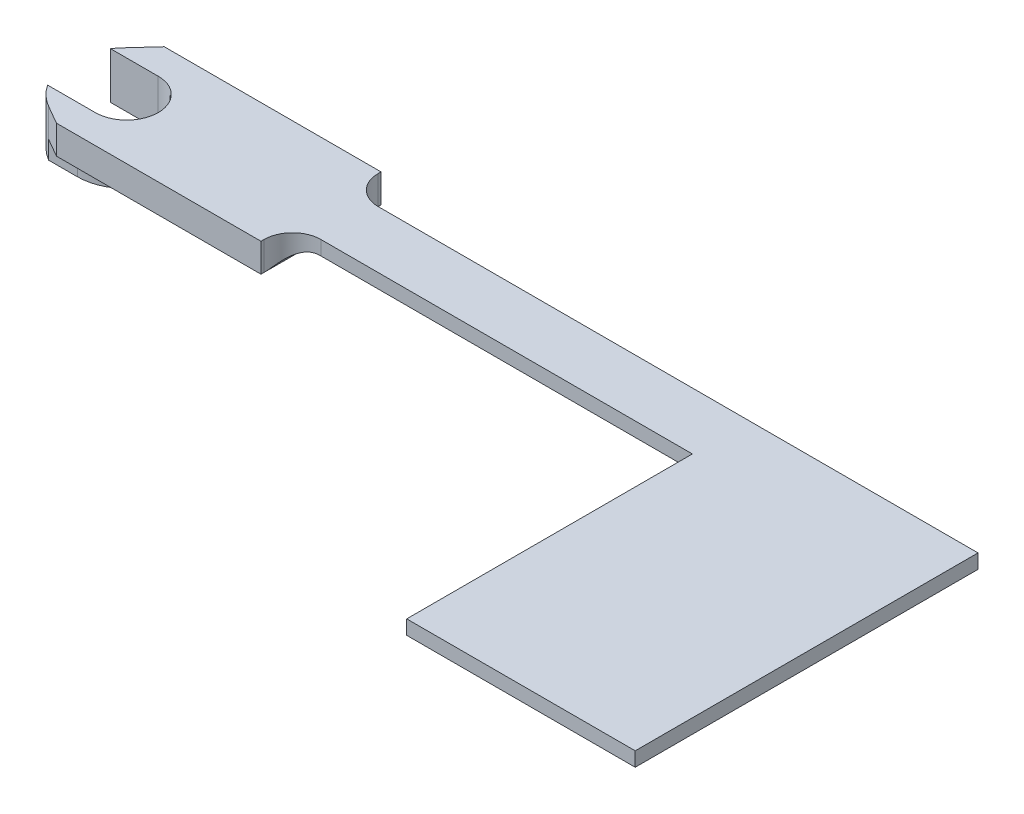
from build123d import *

# Parameters (mm, degrees)
BOSS_EXTRUDE1_DEPTH = 4.7625
SKETCH5_R           = 3.5000057
CUT_EXTRUDE2_DEPTH  = 3.37125
CUT_EXTRUDE3_START  = 1.98
CUT_EXTRUDE3_DEPTH  = 1.98
SKETCH10_W          = 6.35
SKETCH10_H          = 0.79375
SKETCH10_W_2        = 35.745198541
SKETCH10_W_3        = 19.548012242
CUT_EXTRUDE4_DEPTH  = 68.70484365
CUT_EXTRUDE5_DEPTH  = 2.54
BOSS_EXTRUDE2_START = 2
BOSS_EXTRUDE2_DEPTH = 2
CUT_EXTRUDE6_DEPTH  = 62.875089873
BOSS_EXTRUDE4_REACH = 26.955
SKETCH15_W          = 13.3500114
SKETCH15_H          = 3.175
SKETCH15_W_2        = 4.031850112
SKETCH15_H_2        = 1.98
SKETCH20_W          = 13.3500114
SKETCH20_H          = 3.175
BOSS_EXTRUDE7_DEPTH = 3.175
SKETCH21_W          = 25.4
SKETCH21_H          = 31.75
BOSS_EXTRUDE8_DEPTH = 1.5875
FILLET1_R           = 3.175


with BuildPart() as part:
    # Sketch1 → Boss-Extrude1 (new body)
    with BuildSketch(Plane(origin=(0, 0, 0), x_dir=(1, 0, 0), z_dir=(0, 1, 0))):
        with BuildLine():
            Line((23.295952901, 15.613744639), (32.606191406, 26.334377035))
            ThreePointArc((32.606191406, 26.334377035), (32.033289602, 35.241600739), (23.119772343, 34.776777479))
            Line((23.119772343, 34.776777479), (-4.692006503, 4.278735207))
            ThreePointArc((-4.692006503, 4.278735207), (-6.274930424, -0.973523588), (-3.175, -5.499261314))
            Line((-3.175, -5.499261314), (27.78125, -23.371860585))
            ThreePointArc((27.78125, -23.371860585), (37.752424387, -26.756618196), (48.25987898, -26.067923237))
            ThreePointArc((48.25987898, -26.067923237), (49.382410995, -24.123640754), (47.438128512, -23.001108739))
            ThreePointArc((47.438128512, -23.001108739), (21.083895316, -12.623567162), (23.295952901, 15.613744639))
        make_face()
    extrude(amount=BOSS_EXTRUDE1_DEPTH)

    # Sketch5 → Cut-Extrude2 (cut)
    with BuildSketch(Plane.XZ):
        Circle(SKETCH5_R)
        with BuildLine():
            ThreePointArc((0, -3.5000057), (-3.5000057, 0), (0, 3.5000057))
            Line((0, 3.5000057), (-5.298345034, 3.5000057))
            ThreePointArc((-5.298345034, 3.5000057), (-6.35, 0), (-5.298345034, -3.5000057))
            Line((-5.298345034, -3.5000057), (0, -3.5000057))
        make_face()
    extrude(amount=-CUT_EXTRUDE2_DEPTH, mode=Mode.SUBTRACT)

    # Sketch6 → Cut-Extrude3 (cut)
    with BuildSketch(Plane.XZ.offset(-3.37125).offset(CUT_EXTRUDE3_START)):
        with BuildLine():
            Line((17.802786704, -2), (17.802786704, 2))
            Line((17.802786704, 2), (1.802786704, 3))
            ThreePointArc((1.802786704, 3), (3.5000057, 0), (1.802786704, -3))
            Line((1.802786704, -3), (17.802786704, -2))
        make_face()
    extrude(amount=-CUT_EXTRUDE3_DEPTH, mode=Mode.SUBTRACT)

    # Sketch10 → Cut-Extrude4 (cut, through all)
    with BuildSketch(Plane(origin=(-3.175, 0, 5.499261314), x_dir=(0.8660254037844385, 0, 0.5000000000000003), z_dir=(-0.5000000000000003, 0, 0.8660254037844385))):
        with Locations((-3.175, 4.365625)):
            Rectangle(SKETCH10_W, SKETCH10_H)
        with Locations((17.872599271, 4.365625)):
            Rectangle(SKETCH10_W_2, SKETCH10_H)
        with Locations((45.519204662, 4.365625)):
            Rectangle(SKETCH10_W_3, SKETCH10_H)
        with Locations((45.519204662, 0.396875)):
            Rectangle(SKETCH10_W_3, SKETCH10_H)
        with Locations((17.872599271, 0.396875)):
            Rectangle(SKETCH10_W_2, SKETCH10_H)
        with Locations((-3.175, 0.396875)):
            Rectangle(SKETCH10_W, SKETCH10_H)
    extrude(amount=-CUT_EXTRUDE4_DEPTH, mode=Mode.SUBTRACT)

    # Sketch11 → Cut-Extrude5 (cut)
    with BuildSketch(Plane.XZ.offset(-3.37125)):
        with BuildLine():
            Line((-5.298345034, 3.5000057), (0, 3.5000057))
            ThreePointArc((0, 3.5000057), (3.5000057, 0), (0, -3.5000057))
            Line((0, -3.5000057), (-5.298345034, -3.5000057))
            ThreePointArc((-5.298345034, -3.5000057), (-6.35, 0), (-5.298345034, 3.5000057))
        make_face()
    extrude(amount=-CUT_EXTRUDE5_DEPTH, mode=Mode.SUBTRACT)

    # Sketch12 → Boss-Extrude2 (add)
    with BuildSketch(Plane.XZ.offset(-0.79375).offset(BOSS_EXTRUDE2_START)):
        with BuildLine():
            Line((-3.175, 5.499261314), (-3.173710686, 5.5000057))
            Line((-3.173710686, 5.5000057), (0, 5.5000057))
            ThreePointArc((0, 5.5000057), (5.5000057, 0), (0, -5.5000057))
            Line((0, -5.5000057), (-3.57830535, -5.5000057))
            Line((-3.57830535, -5.5000057), (-4.692006503, -4.278735207))
            ThreePointArc((-4.692006503, -4.278735207), (-5.010327921, -3.901168303), (-5.298345034, -3.5000057))
            Line((-5.298345034, -3.5000057), (0, -3.5000057))
            ThreePointArc((0, -3.5000057), (3.5000057, 0), (0, 3.5000057))
            Line((0, 3.5000057), (-5.298345034, 3.5000057))
            ThreePointArc((-5.298345034, 3.5000057), (-4.353004683, 4.623186156), (-3.175, 5.499261314))
        make_face()
    extrude(amount=-BOSS_EXTRUDE2_DEPTH)

    # Sketch14 → Cut-Extrude6 (cut, through all)
    with BuildSketch(Plane(origin=(0, 3.96875, 0), x_dir=(1, 0, 0), z_dir=(0, 1, 0))):
        with BuildLine():
            Line((-2.50679919, 6.6750057), (18.4171905, 6.6750057))
            ThreePointArc((18.4171905, 6.6750057), (20.373146549, 11.408228546), (23.295952901, 15.613744639))
            Line((23.295952901, 15.613744639), (32.606191406, 26.334377035))
            ThreePointArc((32.606191406, 26.334377035), (32.033289602, 35.241600739), (23.119772343, 34.776777479))
            Line((23.119772343, 34.776777479), (-2.50679919, 6.6750057))
        make_face()
        with BuildLine():
            ThreePointArc((47.438128512, -23.001108739), (29.599662599, -20.753834653), (18.4171905, -6.6750057))
            Line((18.4171905, -6.6750057), (-1.138550987, -6.6750057))
            Line((-1.138550987, -6.6750057), (27.78125, -23.371860585))
            ThreePointArc((27.78125, -23.371860585), (37.752424387, -26.756618196), (48.25987898, -26.067923237))
            ThreePointArc((48.25987898, -26.067923237), (49.382410995, -24.123640754), (47.438128512, -23.001108739))
        make_face()
    extrude(amount=-CUT_EXTRUDE6_DEPTH, mode=Mode.SUBTRACT)

    # Sketch15 → Boss-Extrude4 (add, up to next)
    with BuildSketch(Plane(origin=(18.4171905, 0, 0), x_dir=(0, 0, -1), z_dir=(1, 0, 0)), mode=Mode.PRIVATE) as boss_extrude4_sk1:
        with Locations((0, 2.38125)):
            Rectangle(SKETCH15_W, SKETCH15_H)
        with Locations((0, 2.38125)):
            Rectangle(SKETCH15_W_2, SKETCH15_H_2, mode=Mode.SUBTRACT)
    boss_extrude4_tool1 = extrude(boss_extrude4_sk1.sketch, amount=-BOSS_EXTRUDE4_REACH, mode=Mode.PRIVATE) - part.part
    add(boss_extrude4_tool1.solids().sort_by_distance((18.41719, 2.38125, -6.537782))[0])

    # Sketch20 → Boss-Extrude7 (add)
    with BuildSketch(Plane(origin=(18.4171905, 0, 0), x_dir=(0, 0, -1), z_dir=(1, 0, 0))):
        with Locations((0, 2.38125)):
            Rectangle(SKETCH20_W, SKETCH20_H)
    extrude(amount=BOSS_EXTRUDE7_DEPTH)

    # Sketch21 → Boss-Extrude8 (add)
    with BuildSketch(Plane(origin=(0, 3.96875, 0), x_dir=(1, 0, 0), z_dir=(0, 1, 0))):
        with Locations((78.7421905, -19.05)):
            Rectangle(SKETCH21_W, SKETCH21_H)
        Polygon((91.4421905, 3.175), (21.5921905, 3.175), (21.5921905, -3.175), (66.0421905, -3.175), (91.4421905, -3.175), align=None)
    extrude(amount=-BOSS_EXTRUDE8_DEPTH)

    # Fillet1
    # the kernel refuses this fillet: 3.175 mm, written as the material it adds along each edge
    with BuildSketch(Plane(origin=(21.5921905, 3.96875, 3.175), x_dir=(0, 0, 1), z_dir=(0, -1, 0))) as fillet1_piece_1:
        with BuildLine():
            CenterArc((FILLET1_R, -FILLET1_R), FILLET1_R, 90, 90)
            Line((0, -FILLET1_R), (-FILLET1_R * 0.02, -FILLET1_R))
            Line((-FILLET1_R * 0.02, -FILLET1_R), (-FILLET1_R * 0.02, FILLET1_R * 0.02))
            Line((-FILLET1_R * 0.02, FILLET1_R * 0.02), (FILLET1_R, FILLET1_R * 0.02))
            Line((FILLET1_R, FILLET1_R * 0.02), (FILLET1_R, 0))
        make_face()
    extrude(amount=1.5875)
    with BuildSketch(Plane(origin=(21.5921905, 3.96875, -3.175), x_dir=(0, 0, -1), z_dir=(0, -1, 0))) as fillet1_piece_2:
        with BuildLine():
            CenterArc((FILLET1_R, FILLET1_R), FILLET1_R, 180, 90)
            Line((0, FILLET1_R), (-FILLET1_R * 0.02, FILLET1_R))
            Line((-FILLET1_R * 0.02, FILLET1_R), (-FILLET1_R * 0.02, -FILLET1_R * 0.02))
            Line((-FILLET1_R * 0.02, -FILLET1_R * 0.02), (FILLET1_R, -FILLET1_R * 0.02))
            Line((FILLET1_R, -FILLET1_R * 0.02), (FILLET1_R, 0))
        make_face()
    extrude(amount=1.5875)
    with BuildSketch(Plane(origin=(21.5921905, 2.38125, -3.175), x_dir=(0, -1, 0), z_dir=(0, 0, 1))) as fillet1_piece_3:
        with BuildLine():
            CenterArc((3.175, 2.749630657), FILLET1_R, 180, 60)
            Line((0, 2.749630657), (-0.0635, 2.749630657))
            Line((-0.0635, 2.749630657), (-0.0635, 0))
            Line((-0.0635, 0), (0, -0.0635))
            ThreePointArc((0, -0.0635), (0.79375, -0.0635), (1.55575, -0.054992613))
            Line((1.55575, -0.054992613), (1.5875, 0))
        make_face()
    extrude(amount=6.35)
    with BuildSketch(Plane(origin=(21.5921905, 3.96875, 3.175), x_dir=(0, 0, 1), z_dir=(0, -1, 0))) as fillet1_piece_4a_section:
        with BuildLine():
            CenterArc((FILLET1_R, -FILLET1_R), FILLET1_R, 90, 90)
            Line((0, -FILLET1_R), (-FILLET1_R * 0.02, -FILLET1_R))
            Line((-FILLET1_R * 0.02, -FILLET1_R), (-FILLET1_R * 0.02, FILLET1_R * 0.02))
            Line((-FILLET1_R * 0.02, FILLET1_R * 0.02), (FILLET1_R, FILLET1_R * 0.02))
            Line((FILLET1_R, FILLET1_R * 0.02), (FILLET1_R, 0))
        make_face()
    fillet1_piece_4a = extrude(amount=9.525, mode=Mode.PRIVATE)
    fillet1_piece_4a = split(fillet1_piece_4a, bisect_by=Plane(origin=(22.310994987, 0.79375, 3.893804488), z_dir=(0, 1, 0)), keep=Keep.TOP, mode=Mode.PRIVATE)
    fillet1_piece_4a = split(fillet1_piece_4a, bisect_by=Plane(origin=(22.310994987, 2.38125, 3.893804488), z_dir=(0, -1, 0)), keep=Keep.TOP, mode=Mode.PRIVATE)
    with BuildSketch(Plane(origin=(21.5921905, 2.38125, -3.175), x_dir=(0, -1, 0), z_dir=(0, 0, 1))) as fillet1_piece_4b_section:
        with BuildLine():
            CenterArc((3.175, 2.749630657), FILLET1_R, 180, 60)
            Line((0, 2.749630657), (-0.0635, 2.749630657))
            Line((-0.0635, 2.749630657), (-0.0635, 0))
            Line((-0.0635, 0), (0, -0.0635))
            ThreePointArc((0, -0.0635), (0.79375, -0.0635), (1.55575, -0.054992613))
            Line((1.55575, -0.054992613), (1.5875, 0))
        make_face()
    fillet1_piece_4b = extrude(amount=13.224076643, mode=Mode.PRIVATE)
    fillet1_piece_4b = split(fillet1_piece_4b, bisect_by=Plane(origin=(22.278976165, 1.970034442, 6.6750057), z_dir=(0, 0, -1)), keep=Keep.TOP, mode=Mode.PRIVATE)
    fillet1_piece_4b = split(fillet1_piece_4b, bisect_by=Plane(origin=(22.278976165, 1.970034442, 3.175), z_dir=(0, 0, 1)), keep=Keep.TOP, mode=Mode.PRIVATE)
    fillet1_piece_4 = fillet1_piece_4a & fillet1_piece_4b
    add(fillet1_piece_4)
    with BuildSketch(Plane(origin=(21.5921905, 2.38125, -10.049076643), x_dir=(0, -1, 0), z_dir=(0, 0, 1))) as fillet1_piece_5a_section:
        with BuildLine():
            CenterArc((3.175, 2.749630657), FILLET1_R, 180, 60)
            Line((0, 2.749630657), (-0.0635, 2.749630657))
            Line((-0.0635, 2.749630657), (-0.0635, 0))
            Line((-0.0635, 0), (0, -0.0635))
            ThreePointArc((0, -0.0635), (0.79375, -0.0635), (1.55575, -0.054992613))
            Line((1.55575, -0.054992613), (1.5875, 0))
        make_face()
    fillet1_piece_5a = extrude(amount=13.224076643, mode=Mode.PRIVATE)
    fillet1_piece_5a = split(fillet1_piece_5a, bisect_by=Plane(origin=(22.278976165, 1.970034442, -6.6750057), z_dir=(0, 0, 1)), keep=Keep.TOP, mode=Mode.PRIVATE)
    fillet1_piece_5a = split(fillet1_piece_5a, bisect_by=Plane(origin=(22.278976165, 1.970034442, -3.175), z_dir=(0, 0, -1)), keep=Keep.TOP, mode=Mode.PRIVATE)
    with BuildSketch(Plane(origin=(21.5921905, 3.96875, -3.175), x_dir=(0, 0, -1), z_dir=(0, -1, 0))) as fillet1_piece_5b_section:
        with BuildLine():
            CenterArc((FILLET1_R, FILLET1_R), FILLET1_R, 180, 90)
            Line((0, FILLET1_R), (-FILLET1_R * 0.02, FILLET1_R))
            Line((-FILLET1_R * 0.02, FILLET1_R), (-FILLET1_R * 0.02, -FILLET1_R * 0.02))
            Line((-FILLET1_R * 0.02, -FILLET1_R * 0.02), (FILLET1_R, -FILLET1_R * 0.02))
            Line((FILLET1_R, -FILLET1_R * 0.02), (FILLET1_R, 0))
        make_face()
    fillet1_piece_5b = extrude(amount=9.525, mode=Mode.PRIVATE)
    fillet1_piece_5b = split(fillet1_piece_5b, bisect_by=Plane(origin=(22.310994987, 0.79375, -3.893804488), z_dir=(0, 1, 0)), keep=Keep.TOP, mode=Mode.PRIVATE)
    fillet1_piece_5b = split(fillet1_piece_5b, bisect_by=Plane(origin=(22.310994987, 2.38125, -3.893804488), z_dir=(0, -1, 0)), keep=Keep.TOP, mode=Mode.PRIVATE)
    fillet1_piece_5 = fillet1_piece_5a & fillet1_piece_5b
    add(fillet1_piece_5)


solid = part.part
